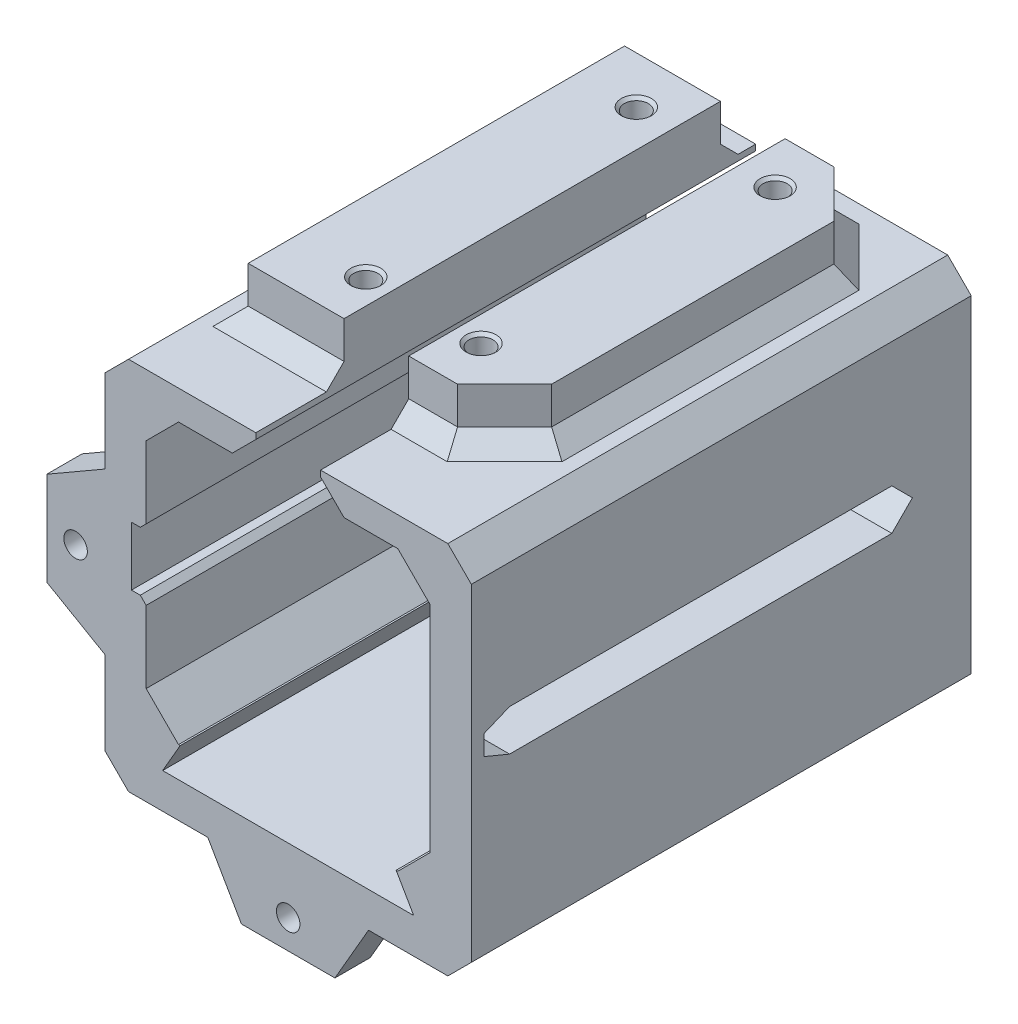
from build123d import *

# Parameters (mm, degrees)
BOSS_EXTRUDE1_DEPTH     = 100
BOSS_EXTRUDE2_DEPTH     = 100
CUT_EXTRUDE1_DEPTH      = 10
CHAMFER1_SIZE           = 5.5
CHAMFER2_SIZE           = 4
SKETCH8_R               = 2
BOSS_EXTRUDE3_DEPTH     = 9.3
CUT_EXTRUDE3_DEPTH      = 125.214315536
CUT_EXTRUDE3_DEPTH_BACK = 10
SKETCH9_W               = 11
SKETCH9_H               = 9.3
CHAMFER3_SIZE           = 4
CHAMFER4_SIZE           = 3
CHAMFER5_SIZE           = 3
SKETCH10_W              = 5
SKETCH10_H              = 10
CUT_EXTRUDE4_DEPTH      = 94
CHAMFER7_SIZE           = 1
CHAMFER8_SIZE           = 1
SKETCH11_R              = 2.05
CUT_EXTRUDE5_DEPTH      = 10
CHAMFER9_SIZE           = 0.5
SKETCH12_R              = 2
CUT_EXTRUDE6_DEPTH      = 15
SKETCH20_W              = 62.3
SKETCH20_H              = 63.674798271
CUT_EXTRUDE14_DEPTH     = 15
BOSS_EXTRUDE4_DEPTH     = 6
SKETCH22_R              = 2
CUT_EXTRUDE15_DEPTH     = 10
CHAMFER10_SIZE          = 1
CHAMFER10_SIZE2         = 0.414213562
CHAMFER11_SIZE          = 1
CHAMFER11_SIZE2         = 0.414213562


with BuildPart() as part:
    # Sketch4 → Boss-Extrude1 (new body)
    with BuildSketch(Plane.XY):
        Polygon((-18.358738987, 4.974798271), (-27, 4.974798271), (-27, -6.2), (27, -6.2), (27, 4.974798271), (18.358738987, 4.974798271), (21.346410162, -0.2), (-21.346410162, -0.2), align=None)
    extrude(amount=BOSS_EXTRUDE1_DEPTH)

    # Sketch6 → Boss-Extrude2 (add)
    with BuildSketch(Plane.XY.offset(100)):
        Polygon((-24.15, 4.974798271), (-24.15, 52.474798271), (-5.5, 52.474798271), (-5.5, 57.474798271), (-31.15, 57.474798271), (-31.15, -6.2), (-24.15, -6.2), align=None)
        Polygon((24.15, -6.2), (24.15, 52.474798271), (5.5, 52.474798271), (5.5, 57.474798271), (31.15, 57.474798271), (31.15, -6.2), align=None)
    extrude(amount=-BOSS_EXTRUDE2_DEPTH)

    # Sketch7 → Cut-Extrude1 (cut)
    with BuildSketch(Plane(origin=(31.15, 0, 0), x_dir=(0, 0, -1), z_dir=(1, 0, 0))):
        Polygon((-85, 28.724798271), (-81.5, 25.224798271), (-13.5, 25.224798271), (-10, 28.724798271), (-13.5, 32.224798271), (-81.5, 32.224798271), align=None)
    extrude(amount=-CUT_EXTRUDE1_DEPTH, mode=Mode.SUBTRACT)

    # Chamfer1
    chamfer1_edges = [part.edges().sort_by_distance(p)[0] for p in [
        (-24.15, 52.474798271, 50),
        (-24.15, 4.974798271, 50),
        (24.15, 4.974798271, 50),
        (24.15, 52.474798271, 50),
    ]]
    chamfer(chamfer1_edges, length=CHAMFER1_SIZE)

    # Chamfer2
    chamfer2_edges = [part.edges().sort_by_distance(p)[0] for p in [
        (-5.5, 52.474798271, 50),
        (5.5, 52.474798271, 50),
    ]]
    chamfer(chamfer2_edges, length=CHAMFER2_SIZE)

    # Sketch8 → Boss-Extrude3 (add)
    with BuildSketch(Plane(origin=(0, 57.474798271, 0), x_dir=(1, 0, 0), z_dir=(0, 1, 0))):
        Polygon((-21.8, -70), (13.8, -70), (21.8, -62), (21.8, -14), (13.8, -6), (-21.8, -6), align=None)
        with Locations(Location((9.8, -62, 0), (0, 0, 270))):
            Circle(SKETCH8_R, mode=Mode.SUBTRACT)
        with Locations(Location((11.8, -14, 0), (0, 0, 270))):
            Circle(SKETCH8_R, mode=Mode.SUBTRACT)
        with Locations(Location((-11.8, -14, 0), (0, 0, 270))):
            Circle(SKETCH8_R, mode=Mode.SUBTRACT)
        with Locations(Location((-9.8, -62, 0), (0, 0, 270))):
            Circle(SKETCH8_R, mode=Mode.SUBTRACT)
    extrude(amount=BOSS_EXTRUDE3_DEPTH)

    # Sketch9 → Cut-Extrude3 (cut, two sides: drawn at the far end of the back side and taken through both)
    with BuildSketch(Plane.XY.offset(-CUT_EXTRUDE3_DEPTH_BACK)):
        with Locations((0, 62.124798271)):
            Rectangle(SKETCH9_W, SKETCH9_H)
    extrude(amount=CUT_EXTRUDE3_DEPTH + CUT_EXTRUDE3_DEPTH_BACK, mode=Mode.SUBTRACT)

    # Chamfer3
    chamfer3_edges = [part.edges().sort_by_distance(p)[0] for p in [
        (-31.15, -6.2, 50),
        (-31.15, 57.474798271, 50),
        (31.15, -6.2, 50),
        (31.15, 57.474798271, 50),
    ]]
    chamfer(chamfer3_edges, length=CHAMFER3_SIZE)

    # Chamfer4
    chamfer4_edges = [part.edges().sort_by_distance(p)[0] for p in [
        (9.65, 57.474798271, 70),
        (-21.8, 57.474798271, 38),
        (-13.65, 57.474798271, 70),
        (17.8, 57.474798271, 66),
        (21.8, 57.474798271, 38),
        (17.8, 57.474798271, 10),
        (9.65, 57.474798271, 6),
        (-13.65, 57.474798271, 6),
    ]]
    chamfer(chamfer4_edges, length=CHAMFER4_SIZE)

    # Chamfer5
    # the kernel refuses this chamfer: 3 mm, written as the material it adds along each edge
    with BuildSketch(Plane(origin=(31.15, 25.224798271, 81.5), x_dir=(0, -0.014760203742521738, -0.9998910622590239), z_dir=(-1, 0, 0)), Plane(origin=(31.15, 32.224798271, 81.5), x_dir=(0, -0.6965927104131427, 0.7174667907292097), z_dir=(-1, 0, 0))) as chamfer5_piece_1:
        Polygon((CHAMFER5_SIZE * 0.999891062259, -CHAMFER5_SIZE * 0.0147602037425), (-CHAMFER5_SIZE * 0.717466790729, -CHAMFER5_SIZE * 0.696592710413), (0, 0), align=None)
    extrude(amount=7)
    with BuildSketch(Plane(origin=(31.15, 28.724798271, 85), x_dir=(0, 0.7262819568766863, -0.687396915264661), z_dir=(-1, 0, 0))) as chamfer5_piece_2:
        Polygon((CHAMFER5_SIZE * 0.999621916911, CHAMFER5_SIZE * 0.0274958766106), (-CHAMFER5_SIZE * 0.0274958766106, CHAMFER5_SIZE * 0.999621916911), (0, 0), align=None)
    extrude(amount=7)

    # Sketch10 → Cut-Extrude4 (cut)
    with BuildSketch(Plane.XY.offset(100)):
        with Locations((-24.15, 28.724798271)):
            Rectangle(SKETCH10_W, SKETCH10_H)
    extrude(amount=-CUT_EXTRUDE4_DEPTH, mode=Mode.SUBTRACT)

    # Chamfer7
    chamfer7_edges = [part.edges().sort_by_distance(p)[0] for p in [
        (-24.15, 28.724798271, 6),
    ]]
    chamfer(chamfer7_edges, length=CHAMFER7_SIZE)

    # Chamfer8
    chamfer8_edges = [part.edges().sort_by_distance(p)[0] for p in [
        (-24.15, 23.724798271, 52.5),
        (-24.15, 33.724798271, 52.5),
    ]]
    chamfer(chamfer8_edges, length=CHAMFER8_SIZE)

    # Sketch11 → Cut-Extrude5 (cut)
    with BuildSketch(Plane(origin=(0, 66.774798271, 0), x_dir=(1, 0, 0), z_dir=(0, 1, 0))):
        with Locations(Location((-11.8, -14, 0), (0, 0, 270))):
            Circle(SKETCH11_R)
        with Locations(Location((11.8, -14, 0), (0, 0, 270))):
            Circle(SKETCH11_R)
        with Locations(Location((-9.8, -62, 0), (0, 0, 270))):
            Circle(SKETCH11_R)
        with Locations(Location((9.8, -62, 0), (0, 0, 270))):
            Circle(SKETCH11_R)
    extrude(amount=-CUT_EXTRUDE5_DEPTH, mode=Mode.SUBTRACT)

    # Chamfer9
    chamfer9_edges = [part.edges().sort_by_distance(p)[0] for p in [
        (11.8, 66.774798271, 11.95),
        (-9.8, 66.774798271, 59.95),
        (9.8, 66.774798271, 59.95),
        (-11.8, 66.774798271, 11.95),
    ]]
    chamfer(chamfer9_edges, length=CHAMFER9_SIZE)

    # Sketch12 → Cut-Extrude6 (cut)
    with BuildSketch(Plane.XY):
        with Locations((-25, 52.724798271)):
            Circle(SKETCH12_R)
        with Locations((25, 52.724798271)):
            Circle(SKETCH12_R)
        with Locations((-25, 2.724798271)):
            Circle(SKETCH12_R)
        with Locations((25, 2.724798271)):
            Circle(SKETCH12_R)
    extrude(amount=CUT_EXTRUDE6_DEPTH, mode=Mode.SUBTRACT)

    # Sketch20 → Cut-Extrude14 (cut)
    with BuildSketch(Plane.XY.offset(100)):
        with Locations((0, 25.637399136)):
            Rectangle(SKETCH20_W, SKETCH20_H)
    extrude(amount=-CUT_EXTRUDE14_DEPTH, mode=Mode.SUBTRACT)

    # Sketch21 → Boss-Extrude4 (add)
    with BuildSketch(Plane.XY.offset(85)):
        Polygon((-31.15, 11.971631471), (-41.05, 17.687399136), (-41.05, 33.587399136), (-31.15, 39.303166801), align=None)
        Polygon((-13.665767665, -6.2), (-7.95, -16.1), (7.95, -16.1), (13.665767665, -6.2), align=None)
    extrude(amount=-BOSS_EXTRUDE4_DEPTH)

    # Sketch22 → Cut-Extrude15 (cut)
    with BuildSketch(Plane.XY.offset(85)):
        with Locations((-36.15, 25.637399136)):
            Circle(SKETCH22_R)
        with Locations((0, -11.2)):
            Circle(SKETCH22_R)
    extrude(amount=-CUT_EXTRUDE15_DEPTH, mode=Mode.SUBTRACT)

    # Chamfer10
    chamfer10_edges = [part.edges().sort_by_distance(p)[0] for p in [
        (0, -6.2, 79),
    ]]
    chamfer10_side = [part.faces().sort_by_distance(p)[0] for p in [
        (-10.556136515, -11.004653619, 79),
    ]]
    chamfer(chamfer10_edges, length=CHAMFER10_SIZE, length2=CHAMFER10_SIZE2, reference=chamfer10_side[0])

    # Chamfer11
    chamfer11_edges = [part.edges().sort_by_distance(p)[0] for p in [
        (-31.15, 25.637399136, 79),
    ]]
    chamfer11_side = [part.faces().sort_by_distance(p)[0] for p in [
        (-35.954653619, 15.08126262, 79),
    ]]
    chamfer(chamfer11_edges, length=CHAMFER11_SIZE, length2=CHAMFER11_SIZE2, reference=chamfer11_side[0])


solid = part.part
